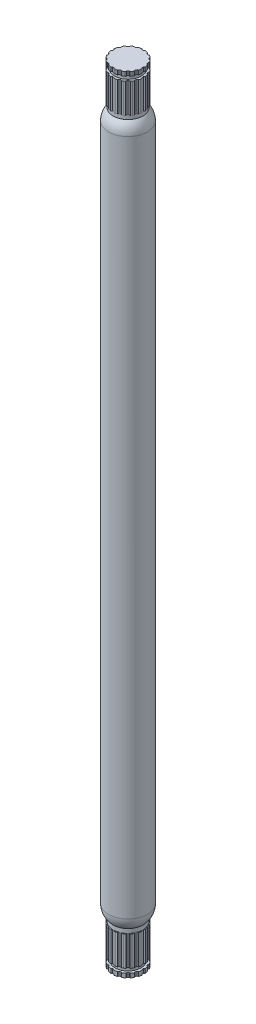
from build123d import *

# Parameters (mm, degrees)
SKETCH1_R            = 11.65
BOSS_EXTRUDE1_DEPTH  = 420
SKETCH3_R            = 8.9
BOSS_EXTRUDE2_DEPTH  = 2.5
BOSS_EXTRUDE6_DEPTH  = 17.8
SKETCH8_R            = 8.016748148
BOSS_EXTRUDE7_DEPTH  = 2.5
SKETCH9_R            = 8.016748148
BOSS_EXTRUDE9_DEPTH  = 2.5
FILLET1_R            = 10
SKETCH13_R           = 8.897382702
BOSS_EXTRUDE10_DEPTH = 2.5
BOSS_EXTRUDE11_DEPTH = 17.8
SKETCH15_R           = 7.804863568
BOSS_EXTRUDE12_DEPTH = 2.5
BOSS_EXTRUDE15_DEPTH = 2.5
FILLET2_R            = 10


with BuildPart() as part:
    # Sketch1 → Boss-Extrude1 (new body)
    with BuildSketch(Plane(origin=(0, 0, 0), x_dir=(1, 0, 0), z_dir=(0, 1, 0))):
        with Locations(Location((0, 0, 0), (0, 0, 90))):
            Circle(SKETCH1_R)
    extrude(amount=BOSS_EXTRUDE1_DEPTH)

    # Sketch3 → Boss-Extrude2 (add)
    with BuildSketch(Plane(origin=(0, 420, 0), x_dir=(1, 0, 0), z_dir=(0, 1, 0))):
        with Locations(Location((0, 0, 0), (0, 0, 270))):
            Circle(SKETCH3_R)
    extrude(amount=BOSS_EXTRUDE2_DEPTH)

    # Sketch4 → Boss-Extrude6 (add)
    with BuildSketch(Plane(origin=(0, 422.5, 0), x_dir=(1, 0, 0), z_dir=(0, 1, 0))):
        with BuildLine():
            Line((0.45, 8.888616315), (-0.45, 8.888616315))
            ThreePointArc((-0.45, 8.888616315), (-1.736303866, 8.728988996), (-2.985780411, 8.384218231))
            Line((-2.985780411, 8.384218231), (-3.81727199, 8.039803141))
            ThreePointArc((-3.81727199, 8.039803141), (-4.944575074, 7.400079549), (-5.96700282, 6.603398923))
            Line((-5.96700282, 6.603398923), (-6.603398923, 5.96700282))
            ThreePointArc((-6.603398923, 5.96700282), (-7.400079549, 4.944575074), (-8.039803141, 3.81727199))
            Line((-8.039803141, 3.81727199), (-8.384218231, 2.985780411))
            ThreePointArc((-8.384218231, 2.985780411), (-8.728988996, 1.736303866), (-8.888616315, 0.45))
            Line((-8.888616315, 0.45), (-8.888616315, -0.45))
            ThreePointArc((-8.888616315, -0.45), (-8.728988996, -1.736303866), (-8.384218231, -2.985780411))
            Line((-8.384218231, -2.985780411), (-8.039803141, -3.81727199))
            ThreePointArc((-8.039803141, -3.81727199), (-7.400079549, -4.944575074), (-6.603398923, -5.96700282))
            Line((-6.603398923, -5.96700282), (-5.96700282, -6.603398923))
            ThreePointArc((-5.96700282, -6.603398923), (-4.944575074, -7.400079549), (-3.81727199, -8.039803141))
            Line((-3.81727199, -8.039803141), (-2.985780411, -8.384218231))
            ThreePointArc((-2.985780411, -8.384218231), (-1.736303866, -8.728988996), (-0.45, -8.888616315))
            Line((-0.45, -8.888616315), (0.45, -8.888616315))
            ThreePointArc((0.45, -8.888616315), (1.736303866, -8.728988996), (2.985780411, -8.384218231))
            Line((2.985780411, -8.384218231), (3.81727199, -8.039803141))
            ThreePointArc((3.81727199, -8.039803141), (4.944575074, -7.400079549), (5.96700282, -6.603398923))
            Line((5.96700282, -6.603398923), (6.603398923, -5.96700282))
            ThreePointArc((6.603398923, -5.96700282), (7.400079549, -4.944575074), (8.039803141, -3.81727199))
            Line((8.039803141, -3.81727199), (8.384218231, -2.985780411))
            ThreePointArc((8.384218231, -2.985780411), (8.728988996, -1.736303866), (8.888616315, -0.45))
            Line((8.888616315, -0.45), (8.888616315, 0.45))
            ThreePointArc((8.888616315, 0.45), (8.728988996, 1.736303866), (8.384218231, 2.985780411))
            Line((8.384218231, 2.985780411), (8.039803141, 3.81727199))
            ThreePointArc((8.039803141, 3.81727199), (7.400079549, 4.944575074), (6.603398923, 5.96700282))
            Line((6.603398923, 5.96700282), (5.96700282, 6.603398923))
            ThreePointArc((5.96700282, 6.603398923), (4.944575074, 7.400079549), (3.81727199, 8.039803141))
            Line((3.81727199, 8.039803141), (2.985780411, 8.384218231))
            ThreePointArc((2.985780411, 8.384218231), (1.736303866, 8.728988996), (0.45, 8.888616315))
        make_face()
        with BuildLine():
            ThreePointArc((-2.985780411, 8.384218231), (-1.736303866, 8.728988996), (-0.45, 8.888616315))
            Line((-0.45, 8.888616315), (-0.980300964, 9.392563005))
            Line((-0.980300964, 9.392563005), (-1.835174079, 9.226043123))
            Line((-1.835174079, 9.226043123), (-2.688698253, 9.052741656))
            Line((-2.688698253, 9.052741656), (-2.985780411, 8.384218231))
        make_face()
        with BuildLine():
            ThreePointArc((-5.96700282, 6.603398923), (-4.944575074, 7.400079549), (-3.81727199, 8.039803141))
            Line((-3.81727199, 8.039803141), (-4.500058246, 8.30245178))
            Line((-4.500058246, 8.30245178), (-5.22613362, 7.821461692))
            Line((-5.22613362, 7.821461692), (-5.948367534, 7.334722453))
            Line((-5.948367534, 7.334722453), (-5.96700282, 6.603398923))
        make_face()
        with BuildLine():
            ThreePointArc((-8.039803141, 3.81727199), (-7.400079549, 4.944575074), (-6.603398923, 5.96700282))
            Line((-6.603398923, 5.96700282), (-7.334722453, 5.948367534))
            Line((-7.334722453, 5.948367534), (-7.821461692, 5.22613362))
            Line((-7.821461692, 5.22613362), (-8.30245178, 4.500058246))
            Line((-8.30245178, 4.500058246), (-8.039803141, 3.81727199))
        make_face()
        with BuildLine():
            ThreePointArc((-8.888616315, 0.45), (-8.728988996, 1.736303866), (-8.384218231, 2.985780411))
            Line((-8.384218231, 2.985780411), (-9.052741656, 2.688698253))
            Line((-9.052741656, 2.688698253), (-9.226043123, 1.835174079))
            Line((-9.226043123, 1.835174079), (-9.392563005, 0.980300964))
            Line((-9.392563005, 0.980300964), (-8.888616315, 0.45))
        make_face()
        with BuildLine():
            Line((4.500058246, 8.30245178), (3.81727199, 8.039803141))
            ThreePointArc((3.81727199, 8.039803141), (4.944575074, 7.400079549), (5.96700282, 6.603398923))
            Line((5.96700282, 6.603398923), (5.948367534, 7.334722453))
            Line((5.948367534, 7.334722453), (5.22613362, 7.821461692))
            Line((5.22613362, 7.821461692), (4.500058246, 8.30245178))
        make_face()
        with BuildLine():
            Line((0.980300964, 9.392563005), (0.45, 8.888616315))
            ThreePointArc((0.45, 8.888616315), (1.736303866, 8.728988996), (2.985780411, 8.384218231))
            Line((2.985780411, 8.384218231), (2.688698253, 9.052741656))
            Line((2.688698253, 9.052741656), (1.835174079, 9.226043123))
            Line((1.835174079, 9.226043123), (0.980300964, 9.392563005))
        make_face()
        with BuildLine():
            Line((7.334722453, 5.948367534), (6.603398923, 5.96700282))
            ThreePointArc((6.603398923, 5.96700282), (7.400079549, 4.944575074), (8.039803141, 3.81727199))
            Line((8.039803141, 3.81727199), (8.30245178, 4.500058246))
            Line((8.30245178, 4.500058246), (7.821461692, 5.22613362))
            Line((7.821461692, 5.22613362), (7.334722453, 5.948367534))
        make_face()
        with BuildLine():
            Line((9.052741656, 2.688698253), (8.384218231, 2.985780411))
            ThreePointArc((8.384218231, 2.985780411), (8.728988996, 1.736303866), (8.888616315, 0.45))
            Line((8.888616315, 0.45), (9.392563005, 0.980300964))
            Line((9.392563005, 0.980300964), (9.226043123, 1.835174079))
            Line((9.226043123, 1.835174079), (9.052741656, 2.688698253))
        make_face()
        with BuildLine():
            Line((9.392563005, -0.980300964), (8.888616315, -0.45))
            ThreePointArc((8.888616315, -0.45), (8.728988996, -1.736303866), (8.384218231, -2.985780411))
            Line((8.384218231, -2.985780411), (9.052741656, -2.688698253))
            Line((9.052741656, -2.688698253), (9.226043123, -1.835174079))
            Line((9.226043123, -1.835174079), (9.392563005, -0.980300964))
        make_face()
        with BuildLine():
            Line((8.30245178, -4.500058246), (8.039803141, -3.81727199))
            ThreePointArc((8.039803141, -3.81727199), (7.400079549, -4.944575074), (6.603398923, -5.96700282))
            Line((6.603398923, -5.96700282), (7.334722453, -5.948367534))
            Line((7.334722453, -5.948367534), (7.821461692, -5.22613362))
            Line((7.821461692, -5.22613362), (8.30245178, -4.500058246))
        make_face()
        with BuildLine():
            Line((5.948367534, -7.334722453), (5.96700282, -6.603398923))
            ThreePointArc((5.96700282, -6.603398923), (4.944575074, -7.400079549), (3.81727199, -8.039803141))
            Line((3.81727199, -8.039803141), (4.500058246, -8.30245178))
            Line((4.500058246, -8.30245178), (5.22613362, -7.821461692))
            Line((5.22613362, -7.821461692), (5.948367534, -7.334722453))
        make_face()
        with BuildLine():
            Line((2.688698253, -9.052741656), (2.985780411, -8.384218231))
            ThreePointArc((2.985780411, -8.384218231), (1.736303866, -8.728988996), (0.45, -8.888616315))
            Line((0.45, -8.888616315), (0.980300964, -9.392563005))
            Line((0.980300964, -9.392563005), (1.835174079, -9.226043123))
            Line((1.835174079, -9.226043123), (2.688698253, -9.052741656))
        make_face()
        with BuildLine():
            ThreePointArc((-0.45, -8.888616315), (-1.736303866, -8.728988996), (-2.985780411, -8.384218231))
            Line((-2.985780411, -8.384218231), (-2.688698253, -9.052741656))
            Line((-2.688698253, -9.052741656), (-1.835174079, -9.226043123))
            Line((-1.835174079, -9.226043123), (-0.980300964, -9.392563005))
            Line((-0.980300964, -9.392563005), (-0.45, -8.888616315))
        make_face()
        with BuildLine():
            ThreePointArc((-3.81727199, -8.039803141), (-4.944575074, -7.400079549), (-5.96700282, -6.603398923))
            Line((-5.96700282, -6.603398923), (-5.948367534, -7.334722453))
            Line((-5.948367534, -7.334722453), (-5.22613362, -7.821461692))
            Line((-5.22613362, -7.821461692), (-4.500058246, -8.30245178))
            Line((-4.500058246, -8.30245178), (-3.81727199, -8.039803141))
        make_face()
        with BuildLine():
            ThreePointArc((-6.603398923, -5.96700282), (-7.400079549, -4.944575074), (-8.039803141, -3.81727199))
            Line((-8.039803141, -3.81727199), (-8.30245178, -4.500058246))
            Line((-8.30245178, -4.500058246), (-7.821461692, -5.22613362))
            Line((-7.821461692, -5.22613362), (-7.334722453, -5.948367534))
            Line((-7.334722453, -5.948367534), (-6.603398923, -5.96700282))
        make_face()
        with BuildLine():
            ThreePointArc((-8.384218231, -2.985780411), (-8.728988996, -1.736303866), (-8.888616315, -0.45))
            Line((-8.888616315, -0.45), (-9.392563005, -0.980300964))
            Line((-9.392563005, -0.980300964), (-9.226043123, -1.835174079))
            Line((-9.226043123, -1.835174079), (-9.052741656, -2.688698253))
            Line((-9.052741656, -2.688698253), (-8.384218231, -2.985780411))
        make_face()
    extrude(amount=BOSS_EXTRUDE6_DEPTH)

    # Sketch8 → Boss-Extrude7 (add)
    with BuildSketch(Plane(origin=(0, 440.3, 0), x_dir=(1, 0, 0), z_dir=(0, 1, 0))):
        with Locations(Location((0, 0, 0), (0, 0, 270))):
            Circle(SKETCH8_R)
    extrude(amount=BOSS_EXTRUDE7_DEPTH)

    # Sketch9 → Boss-Extrude9 (add)
    # profile 1 of 17: a face of its own
    with BuildSketch(Plane(origin=(0, 442.8, 0), x_dir=(1, 0, 0), z_dir=(0, 1, 0))):
        with BuildLine():
            Line((0.45, 8.888616315), (-0.45, 8.888616315))
            ThreePointArc((-0.45, 8.888616315), (-1.736303866, 8.728988996), (-2.985780411, 8.384218231))
            Line((-2.985780411, 8.384218231), (-3.81727199, 8.039803141))
            Line((-3.81727199, 8.039803141), (-4.454837176, 8.285056509))
            ThreePointArc((-4.454837176, 8.285056509), (-4.736292844, 8.127439062), (-5.012178687, 7.960263841))
            Line((-5.012178687, 7.960263841), (-5.436247093, 7.676910392))
            ThreePointArc((-5.436247093, 7.676910392), (-5.696273799, 7.486000296), (-5.949601753, 7.28628675))
            Line((-5.949601753, 7.28628675), (-5.96700282, 6.603398923))
            Line((-5.96700282, 6.603398923), (-6.603398923, 5.96700282))
            ThreePointArc((-6.603398923, 5.96700282), (-7.400079549, 4.944575074), (-8.039803141, 3.81727199))
            Line((-8.039803141, 3.81727199), (-8.384218231, 2.985780411))
            ThreePointArc((-8.384218231, 2.985780411), (-8.728988996, 1.736303866), (-8.888616315, 0.45))
            Line((-8.888616315, 0.45), (-8.888616315, -0.45))
            ThreePointArc((-8.888616315, -0.45), (-8.728988996, -1.736303866), (-8.384218231, -2.985780411))
            Line((-8.384218231, -2.985780411), (-8.039803141, -3.81727199))
            ThreePointArc((-8.039803141, -3.81727199), (-7.400079549, -4.944575074), (-6.603398923, -5.96700282))
            Line((-6.603398923, -5.96700282), (-5.96700282, -6.603398923))
            ThreePointArc((-5.96700282, -6.603398923), (-4.944575074, -7.400079549), (-3.81727199, -8.039803141))
            Line((-3.81727199, -8.039803141), (-2.985780411, -8.384218231))
            ThreePointArc((-2.985780411, -8.384218231), (-1.736303866, -8.728988996), (-0.45, -8.888616315))
            Line((-0.45, -8.888616315), (0.45, -8.888616315))
            ThreePointArc((0.45, -8.888616315), (1.736303866, -8.728988996), (2.985780411, -8.384218231))
            Line((2.985780411, -8.384218231), (3.81727199, -8.039803141))
            ThreePointArc((3.81727199, -8.039803141), (4.944575074, -7.400079549), (5.96700282, -6.603398923))
            Line((5.96700282, -6.603398923), (6.603398923, -5.96700282))
            ThreePointArc((6.603398923, -5.96700282), (7.400079549, -4.944575074), (8.039803141, -3.81727199))
            Line((8.039803141, -3.81727199), (8.384218231, -2.985780411))
            ThreePointArc((8.384218231, -2.985780411), (8.728988996, -1.736303866), (8.888616315, -0.45))
            Line((8.888616315, -0.45), (8.888616315, 0.45))
            ThreePointArc((8.888616315, 0.45), (8.728988996, 1.736303866), (8.384218231, 2.985780411))
            Line((8.384218231, 2.985780411), (8.039803141, 3.81727199))
            ThreePointArc((8.039803141, 3.81727199), (7.400079549, 4.944575074), (6.603398923, 5.96700282))
            Line((6.603398923, 5.96700282), (5.96700282, 6.603398923))
            ThreePointArc((5.96700282, 6.603398923), (4.944575074, 7.400079549), (3.81727199, 8.039803141))
            Line((3.81727199, 8.039803141), (2.985780411, 8.384218231))
            ThreePointArc((2.985780411, 8.384218231), (1.736303866, 8.728988996), (0.45, 8.888616315))
        make_face()
        with Locations(Location((0, 0, 0), (0, 0, 270))):
            Circle(SKETCH9_R, mode=Mode.SUBTRACT)
    # profile 2 of 17: a face of its own
    with BuildSketch(Plane(origin=(0, 442.8, 0), x_dir=(1, 0, 0), z_dir=(0, 1, 0))):
        with Locations(Location((0, 0, 0), (0, 0, 270))):
            Circle(SKETCH9_R)
    # profile 3 of 17: a face of its own
    with BuildSketch(Plane(origin=(0, 442.8, 0), x_dir=(1, 0, 0), z_dir=(0, 1, 0))):
        with BuildLine():
            ThreePointArc((-8.039803141, 3.81727199), (-7.400079549, 4.944575074), (-6.603398923, 5.96700282))
            Line((-6.603398923, 5.96700282), (-7.28628675, 5.949601753))
            ThreePointArc((-7.28628675, 5.949601753), (-7.486000296, 5.696273799), (-7.676910392, 5.436247093))
            Line((-7.676910392, 5.436247093), (-7.960263841, 5.012178687))
            ThreePointArc((-7.960263841, 5.012178687), (-8.127439062, 4.736292844), (-8.285056509, 4.454837176))
            Line((-8.285056509, 4.454837176), (-8.039803141, 3.81727199))
        make_face()
    # profile 4 of 17: a face of its own
    with BuildSketch(Plane(origin=(0, 442.8, 0), x_dir=(1, 0, 0), z_dir=(0, 1, 0))):
        with BuildLine():
            ThreePointArc((-8.888616315, 0.45), (-8.728988996, 1.736303866), (-8.384218231, 2.985780411))
            Line((-8.384218231, 2.985780411), (-9.008465216, 2.708374064))
            ThreePointArc((-9.008465216, 2.708374064), (-9.096032062, 2.397902487), (-9.17290208, 2.084611004))
            Line((-9.17290208, 2.084611004), (-9.27240258, 1.584388213))
            ThreePointArc((-9.27240258, 1.584388213), (-9.321275404, 1.265527742), (-9.359186515, 0.945179026))
            Line((-9.359186515, 0.945179026), (-8.888616315, 0.45))
        make_face()
    # profile 5 of 17: a face of its own
    with BuildSketch(Plane(origin=(0, 442.8, 0), x_dir=(1, 0, 0), z_dir=(0, 1, 0))):
        with BuildLine():
            ThreePointArc((-8.384218231, -2.985780411), (-8.728988996, -1.736303866), (-8.888616315, -0.45))
            Line((-8.888616315, -0.45), (-9.359186515, -0.945179026))
            ThreePointArc((-9.359186515, -0.945179026), (-9.321275404, -1.265527742), (-9.27240258, -1.584388213))
            Line((-9.27240258, -1.584388213), (-9.17290208, -2.084611004))
            ThreePointArc((-9.17290208, -2.084611004), (-9.096032062, -2.397902487), (-9.008465216, -2.708374064))
            Line((-9.008465216, -2.708374064), (-8.384218231, -2.985780411))
        make_face()
    # profile 6 of 17: a face of its own
    with BuildSketch(Plane(origin=(0, 442.8, 0), x_dir=(1, 0, 0), z_dir=(0, 1, 0))):
        with BuildLine():
            ThreePointArc((-6.603398923, -5.96700282), (-7.400079549, -4.944575074), (-8.039803141, -3.81727199))
            Line((-8.039803141, -3.81727199), (-8.285056509, -4.454837176))
            ThreePointArc((-8.285056509, -4.454837176), (-8.127439062, -4.736292844), (-7.960263841, -5.012178687))
            Line((-7.960263841, -5.012178687), (-7.676910392, -5.436247093))
            ThreePointArc((-7.676910392, -5.436247093), (-7.486000296, -5.696273799), (-7.28628675, -5.949601753))
            Line((-7.28628675, -5.949601753), (-6.603398923, -5.96700282))
        make_face()
    # profile 7 of 17: a face of its own
    with BuildSketch(Plane(origin=(0, 442.8, 0), x_dir=(1, 0, 0), z_dir=(0, 1, 0))):
        with BuildLine():
            ThreePointArc((-3.81727199, -8.039803141), (-4.944575074, -7.400079549), (-5.96700282, -6.603398923))
            Line((-5.96700282, -6.603398923), (-5.949601753, -7.28628675))
            ThreePointArc((-5.949601753, -7.28628675), (-5.696273799, -7.486000296), (-5.436247093, -7.676910392))
            Line((-5.436247093, -7.676910392), (-5.012178687, -7.960263841))
            ThreePointArc((-5.012178687, -7.960263841), (-4.736292844, -8.127439062), (-4.454837176, -8.285056509))
            Line((-4.454837176, -8.285056509), (-3.81727199, -8.039803141))
        make_face()
    # profile 8 of 17: a face of its own
    with BuildSketch(Plane(origin=(0, 442.8, 0), x_dir=(1, 0, 0), z_dir=(0, 1, 0))):
        with BuildLine():
            Line((-0.945179026, -9.359186515), (-0.45, -8.888616315))
            ThreePointArc((-0.45, -8.888616315), (-1.736303866, -8.728988996), (-2.985780411, -8.384218231))
            Line((-2.985780411, -8.384218231), (-2.708374064, -9.008465216))
            ThreePointArc((-2.708374064, -9.008465216), (-2.397902487, -9.096032062), (-2.084611004, -9.17290208))
            Line((-2.084611004, -9.17290208), (-1.584388213, -9.27240258))
            ThreePointArc((-1.584388213, -9.27240258), (-1.265527742, -9.321275404), (-0.945179026, -9.359186515))
        make_face()
    # profile 9 of 17: a face of its own
    with BuildSketch(Plane(origin=(0, 442.8, 0), x_dir=(1, 0, 0), z_dir=(0, 1, 0))):
        with BuildLine():
            Line((2.708374064, -9.008465216), (2.985780411, -8.384218231))
            ThreePointArc((2.985780411, -8.384218231), (1.736303866, -8.728988996), (0.45, -8.888616315))
            Line((0.45, -8.888616315), (0.945179026, -9.359186515))
            ThreePointArc((0.945179026, -9.359186515), (1.265527742, -9.321275404), (1.584388213, -9.27240258))
            Line((1.584388213, -9.27240258), (2.084611004, -9.17290208))
            ThreePointArc((2.084611004, -9.17290208), (2.397902487, -9.096032062), (2.708374064, -9.008465216))
        make_face()
    # profile 10 of 17: a face of its own
    with BuildSketch(Plane(origin=(0, 442.8, 0), x_dir=(1, 0, 0), z_dir=(0, 1, 0))):
        with BuildLine():
            Line((5.949601753, -7.28628675), (5.96700282, -6.603398923))
            ThreePointArc((5.96700282, -6.603398923), (4.944575074, -7.400079549), (3.81727199, -8.039803141))
            Line((3.81727199, -8.039803141), (4.454837176, -8.285056509))
            ThreePointArc((4.454837176, -8.285056509), (4.736292844, -8.127439062), (5.012178687, -7.960263841))
            Line((5.012178687, -7.960263841), (5.436247093, -7.676910392))
            ThreePointArc((5.436247093, -7.676910392), (5.696273799, -7.486000296), (5.949601753, -7.28628675))
        make_face()
    # profile 11 of 17: a face of its own
    with BuildSketch(Plane(origin=(0, 442.8, 0), x_dir=(1, 0, 0), z_dir=(0, 1, 0))):
        with BuildLine():
            Line((8.285056509, -4.454837176), (8.039803141, -3.81727199))
            ThreePointArc((8.039803141, -3.81727199), (7.400079549, -4.944575074), (6.603398923, -5.96700282))
            Line((6.603398923, -5.96700282), (7.28628675, -5.949601753))
            ThreePointArc((7.28628675, -5.949601753), (7.486000296, -5.696273799), (7.676910392, -5.436247093))
            Line((7.676910392, -5.436247093), (7.960263841, -5.012178687))
            ThreePointArc((7.960263841, -5.012178687), (8.127439062, -4.736292844), (8.285056509, -4.454837176))
        make_face()
    # profile 12 of 17: a face of its own
    with BuildSketch(Plane(origin=(0, 442.8, 0), x_dir=(1, 0, 0), z_dir=(0, 1, 0))):
        with BuildLine():
            Line((9.359186515, -0.945179026), (8.888616315, -0.45))
            ThreePointArc((8.888616315, -0.45), (8.728988996, -1.736303866), (8.384218231, -2.985780411))
            Line((8.384218231, -2.985780411), (9.008465216, -2.708374064))
            ThreePointArc((9.008465216, -2.708374064), (9.096032062, -2.397902487), (9.17290208, -2.084611004))
            Line((9.17290208, -2.084611004), (9.27240258, -1.584388213))
            ThreePointArc((9.27240258, -1.584388213), (9.321275404, -1.265527742), (9.359186515, -0.945179026))
        make_face()
    # profile 13 of 17: a face of its own
    with BuildSketch(Plane(origin=(0, 442.8, 0), x_dir=(1, 0, 0), z_dir=(0, 1, 0))):
        with BuildLine():
            Line((9.008465216, 2.708374064), (8.384218231, 2.985780411))
            ThreePointArc((8.384218231, 2.985780411), (8.728988996, 1.736303866), (8.888616315, 0.45))
            Line((8.888616315, 0.45), (9.359186515, 0.945179026))
            ThreePointArc((9.359186515, 0.945179026), (9.321275404, 1.265527742), (9.27240258, 1.584388213))
            Line((9.27240258, 1.584388213), (9.17290208, 2.084611004))
            ThreePointArc((9.17290208, 2.084611004), (9.096032062, 2.397902487), (9.008465216, 2.708374064))
        make_face()
    # profile 14 of 17: a face of its own
    with BuildSketch(Plane(origin=(0, 442.8, 0), x_dir=(1, 0, 0), z_dir=(0, 1, 0))):
        with BuildLine():
            Line((7.28628675, 5.949601753), (6.603398923, 5.96700282))
            ThreePointArc((6.603398923, 5.96700282), (7.400079549, 4.944575074), (8.039803141, 3.81727199))
            Line((8.039803141, 3.81727199), (8.285056509, 4.454837176))
            ThreePointArc((8.285056509, 4.454837176), (8.127439062, 4.736292844), (7.960263841, 5.012178687))
            Line((7.960263841, 5.012178687), (7.676910392, 5.436247093))
            ThreePointArc((7.676910392, 5.436247093), (7.486000296, 5.696273799), (7.28628675, 5.949601753))
        make_face()
    # profile 15 of 17: a face of its own
    with BuildSketch(Plane(origin=(0, 442.8, 0), x_dir=(1, 0, 0), z_dir=(0, 1, 0))):
        with BuildLine():
            Line((4.454837176, 8.285056509), (3.81727199, 8.039803141))
            ThreePointArc((3.81727199, 8.039803141), (4.944575074, 7.400079549), (5.96700282, 6.603398923))
            Line((5.96700282, 6.603398923), (5.949601753, 7.28628675))
            ThreePointArc((5.949601753, 7.28628675), (5.696273799, 7.486000296), (5.436247093, 7.676910392))
            Line((5.436247093, 7.676910392), (5.012178687, 7.960263841))
            ThreePointArc((5.012178687, 7.960263841), (4.736292844, 8.127439062), (4.454837176, 8.285056509))
        make_face()
    # profile 16 of 17: a face of its own
    with BuildSketch(Plane(origin=(0, 442.8, 0), x_dir=(1, 0, 0), z_dir=(0, 1, 0))):
        with BuildLine():
            ThreePointArc((-2.985780411, 8.384218231), (-1.736303866, 8.728988996), (-0.45, 8.888616315))
            Line((-0.45, 8.888616315), (-0.945179026, 9.359186515))
            ThreePointArc((-0.945179026, 9.359186515), (-1.265527742, 9.321275404), (-1.584388213, 9.27240258))
            Line((-1.584388213, 9.27240258), (-2.084611004, 9.17290208))
            ThreePointArc((-2.084611004, 9.17290208), (-2.397902487, 9.096032062), (-2.708374064, 9.008465216))
            Line((-2.708374064, 9.008465216), (-2.985780411, 8.384218231))
        make_face()
    # profile 17 of 17: a face of its own
    with BuildSketch(Plane(origin=(0, 442.8, 0), x_dir=(1, 0, 0), z_dir=(0, 1, 0))):
        with BuildLine():
            Line((0.945179026, 9.359186515), (0.45, 8.888616315))
            ThreePointArc((0.45, 8.888616315), (1.736303866, 8.728988996), (2.985780411, 8.384218231))
            Line((2.985780411, 8.384218231), (2.708374064, 9.008465216))
            ThreePointArc((2.708374064, 9.008465216), (2.397902487, 9.096032062), (2.084611004, 9.17290208))
            Line((2.084611004, 9.17290208), (1.584388213, 9.27240258))
            ThreePointArc((1.584388213, 9.27240258), (1.265527742, 9.321275404), (0.945179026, 9.359186515))
        make_face()
    extrude(amount=BOSS_EXTRUDE9_DEPTH)

    # Fillet1
    # the kernel refuses this fillet: 10 mm, written as the material it takes off along each edge
    with BuildSketch(Plane(origin=(0, 420, 0), x_dir=(0, 0, -1), z_dir=(1, 0, 0))) as fillet1_piece_1_section:
        with BuildLine():
            CenterArc((1.65, -6.887488657), FILLET1_R, 0, 43.531152167)
            Line((11.65, -6.887488657), (11.85, -6.887488657))
            Line((11.85, -6.887488657), (11.85, 0))
            Line((11.85, 0), (11.65, 0.2))
            ThreePointArc((11.65, 0.2), (10.275, 0.2), (9.045, 0.137749773))
            Line((9.045, 0.137749773), (8.9, 0))
        make_face()
    fillet1_piece_1 = revolve(axis=Axis((0, 420, 0), (0, 1, 0)), mode=Mode.PRIVATE)
    fillet1_piece_1 = fillet1_piece_1 - Plane(origin=(0, 416.850802747, 0), x_dir=(0, 0, 1), z_dir=(0, -1, 0)) * Cylinder(8.9, 48, mode=Mode.PRIVATE)
    add(fillet1_piece_1, mode=Mode.SUBTRACT)

    # Sketch13 → Boss-Extrude10 (add)
    with BuildSketch(Plane.XZ):
        with Locations(Location((0, 0, 0), (0, 0, 270))):
            Circle(SKETCH13_R)
    extrude(amount=BOSS_EXTRUDE10_DEPTH)

    # Sketch14 → Boss-Extrude11 (add)
    with BuildSketch(Plane.XZ.offset(2.5)):
        Polygon((0.408427035, 8.885811164), (-0.408427035, 8.885811164), (-0.455707732, 8.885811164), (-0.956971521, 9.387074953), (-1.95884562, 9.202875892), (-2.721117428, 9.039705889), (-2.995565895, 8.377128676), (-3.023115337, 8.365717324), (-3.777790094, 8.053120804), (-3.821471762, 8.035027265), (-4.476404464, 8.306309273), (-5.33152551, 7.752730912), (-5.973330374, 7.310272693), (-5.973330374, 6.593104286), (-5.994415804, 6.572018857), (-6.572018857, 5.994415804), (-6.605451358, 5.960983303), (-7.314345407, 5.960983303), (-7.892528971, 5.122302928), (-8.316157919, 4.467916748), (-8.041709452, 3.805339536), (-8.053120804, 3.777790094), (-8.365717324, 3.023115337), (-8.383810863, 2.979433669), (-9.038743566, 2.708151661), (-9.251966443, 1.712050758), (-9.392925808, 0.94536098), (-8.885811164, 0.438246336), (-8.885811164, 0.408427035), (-8.885811164, -0.408427035), (-8.885811164, -0.455707732), (-9.387074953, -0.956971521), (-9.202875892, -1.95884562), (-9.039705889, -2.721117428), (-8.377128676, -2.995565895), (-8.365717324, -3.023115337), (-8.053120804, -3.777790094), (-8.035027265, -3.821471762), (-8.306309273, -4.476404464), (-7.752730912, -5.33152551), (-7.310272693, -5.973330374), (-6.593104286, -5.973330374), (-6.572018857, -5.994415804), (-5.994415804, -6.572018857), (-5.960983303, -6.605451358), (-5.960983303, -7.314345407), (-5.122302928, -7.892528971), (-4.467916748, -8.316157919), (-3.805339536, -8.041709452), (-3.777790094, -8.053120804), (-3.023115337, -8.365717324), (-2.979433669, -8.383810863), (-2.708151661, -9.038743566), (-1.712050758, -9.251966443), (-0.94536098, -9.392925808), (-0.438246336, -8.885811164), (-0.408427035, -8.885811164), (0.408427035, -8.885811164), (0.455707732, -8.885811164), (0.956971521, -9.387074953), (1.95884562, -9.202875892), (2.721117428, -9.039705889), (2.995565895, -8.377128676), (3.023115337, -8.365717324), (3.777790094, -8.053120804), (3.821471762, -8.035027265), (4.476404464, -8.306309273), (5.33152551, -7.752730912), (5.973330374, -7.310272693), (5.973330374, -6.593104286), (5.994415804, -6.572018857), (6.572018857, -5.994415804), (6.605451358, -5.960983303), (7.314345407, -5.960983303), (7.892528971, -5.122302928), (8.316157919, -4.467916748), (8.041709452, -3.805339536), (8.053120804, -3.777790094), (8.365717324, -3.023115337), (8.383810863, -2.979433669), (9.038743566, -2.708151661), (9.251966443, -1.712050758), (9.392925808, -0.94536098), (8.885811164, -0.438246336), (8.885811164, -0.408427035), (8.885811164, 0.408427035), (8.885811164, 0.455707732), (9.387074953, 0.956971521), (9.202875892, 1.95884562), (9.039705889, 2.721117428), (8.377128676, 2.995565895), (8.365717324, 3.023115337), (8.053120804, 3.777790094), (8.035027265, 3.821471762), (8.306309273, 4.476404464), (7.752730912, 5.33152551), (7.310272693, 5.973330374), (6.593104286, 5.973330374), (6.572018857, 5.994415804), (5.994415804, 6.572018857), (5.960983303, 6.605451358), (5.960983303, 7.314345407), (5.122302928, 7.892528971), (4.467916748, 8.316157919), (3.805339536, 8.041709452), (3.777790094, 8.053120804), (3.023115337, 8.365717324), (2.979433669, 8.383810863), (2.708151661, 9.038743566), (1.712050758, 9.251966443), (0.94536098, 9.392925808), (0.438246336, 8.885811164), align=None)
    extrude(amount=BOSS_EXTRUDE11_DEPTH)

    # Sketch15 → Boss-Extrude12 (add)
    with BuildSketch(Plane.XZ.offset(20.3)):
        with Locations(Location((0, 0, 0), (0, 0, 270))):
            Circle(SKETCH15_R)
    extrude(amount=BOSS_EXTRUDE12_DEPTH)

    # Sketch24 → Boss-Extrude15 (add)
    with BuildSketch(Plane.XZ.offset(22.8)):
        with BuildLine():
            Line((-0.455707732, 8.885811164), (-0.956971521, 9.387074953))
            Line((-0.956971521, 9.387074953), (-2.673210301, 9.049139039))
            ThreePointArc((-2.673210301, 9.049139039), (-2.698323685, 9.041682363), (-2.72341627, 9.034155992))
            Line((-2.72341627, 9.034155992), (-2.995565895, 8.377128676))
            Line((-2.995565895, 8.377128676), (-3.821471762, 8.035027265))
            Line((-3.821471762, 8.035027265), (-4.476404464, 8.306309273))
            Line((-4.476404464, 8.306309273), (-5.93267987, 7.337321052))
            ThreePointArc((-5.93267987, 7.337321052), (-5.953028066, 7.320821505), (-5.973330374, 7.304265528))
            Line((-5.973330374, 7.304265528), (-5.973330374, 6.593104286))
            Line((-5.973330374, 6.593104286), (-6.605451358, 5.960983303))
            Line((-6.605451358, 5.960983303), (-7.314345407, 5.960983303))
            Line((-7.314345407, 5.960983303), (-8.28895271, 4.508462448))
            ThreePointArc((-8.28895271, 4.508462448), (-8.301437888, 4.485431937), (-8.313859077, 4.462366851))
            Line((-8.313859077, 4.462366851), (-8.041709452, 3.805339536))
            Line((-8.041709452, 3.805339536), (-8.383810863, 2.979433669))
            Line((-8.383810863, 2.979433669), (-9.038743566, 2.708151661))
            Line((-9.038743566, 2.708151661), (-9.383307639, 0.993231305))
            ThreePointArc((-9.383307639, 0.993231305), (-9.386029044, 0.967176016), (-9.3886781, 0.941113273))
            Line((-9.3886781, 0.941113273), (-8.885811164, 0.438246336))
            Line((-8.885811164, 0.438246336), (-8.885811164, -0.455707732))
            Line((-8.885811164, -0.455707732), (-9.387074953, -0.956971521))
            Line((-9.387074953, -0.956971521), (-9.049139039, -2.673210301))
            ThreePointArc((-9.049139039, -2.673210301), (-9.041682363, -2.698323685), (-9.034155992, -2.72341627))
            Line((-9.034155992, -2.72341627), (-8.377128676, -2.995565895))
            Line((-8.377128676, -2.995565895), (-8.035027265, -3.821471762))
            Line((-8.035027265, -3.821471762), (-8.306309273, -4.476404464))
            Line((-8.306309273, -4.476404464), (-7.337321052, -5.93267987))
            ThreePointArc((-7.337321052, -5.93267987), (-7.320821505, -5.953028066), (-7.304265528, -5.973330374))
            Line((-7.304265528, -5.973330374), (-6.593104286, -5.973330374))
            Line((-6.593104286, -5.973330374), (-5.960983303, -6.605451358))
            Line((-5.960983303, -6.605451358), (-5.960983303, -7.314345407))
            Line((-5.960983303, -7.314345407), (-4.508462448, -8.28895271))
            ThreePointArc((-4.508462448, -8.28895271), (-4.485431937, -8.301437888), (-4.462366851, -8.313859077))
            Line((-4.462366851, -8.313859077), (-3.805339536, -8.041709452))
            Line((-3.805339536, -8.041709452), (-2.979433669, -8.383810863))
            Line((-2.979433669, -8.383810863), (-2.708151661, -9.038743566))
            Line((-2.708151661, -9.038743566), (-0.993231305, -9.383307639))
            ThreePointArc((-0.993231305, -9.383307639), (-0.967176016, -9.386029044), (-0.941113273, -9.3886781))
            Line((-0.941113273, -9.3886781), (-0.438246336, -8.885811164))
            Line((-0.438246336, -8.885811164), (0.455707732, -8.885811164))
            Line((0.455707732, -8.885811164), (0.956971521, -9.387074953))
            Line((0.956971521, -9.387074953), (2.673210301, -9.049139039))
            ThreePointArc((2.673210301, -9.049139039), (2.698323685, -9.041682363), (2.72341627, -9.034155992))
            Line((2.72341627, -9.034155992), (2.995565895, -8.377128676))
            Line((2.995565895, -8.377128676), (3.821471762, -8.035027265))
            Line((3.821471762, -8.035027265), (4.476404464, -8.306309273))
            Line((4.476404464, -8.306309273), (5.93267987, -7.337321052))
            ThreePointArc((5.93267987, -7.337321052), (5.953028066, -7.320821505), (5.973330374, -7.304265528))
            Line((5.973330374, -7.304265528), (5.973330374, -6.593104286))
            Line((5.973330374, -6.593104286), (6.605451358, -5.960983303))
            Line((6.605451358, -5.960983303), (7.314345407, -5.960983303))
            Line((7.314345407, -5.960983303), (8.28895271, -4.508462448))
            ThreePointArc((8.28895271, -4.508462448), (8.301437888, -4.485431937), (8.313859077, -4.462366851))
            Line((8.313859077, -4.462366851), (8.041709452, -3.805339536))
            Line((8.041709452, -3.805339536), (8.383810863, -2.979433669))
            Line((8.383810863, -2.979433669), (9.038743566, -2.708151661))
            Line((9.038743566, -2.708151661), (9.383307639, -0.993231305))
            ThreePointArc((9.383307639, -0.993231305), (9.386029044, -0.967176016), (9.3886781, -0.941113273))
            Line((9.3886781, -0.941113273), (8.885811164, -0.438246336))
            Line((8.885811164, -0.438246336), (8.885811164, 0.455707732))
            Line((8.885811164, 0.455707732), (9.387074953, 0.956971521))
            Line((9.387074953, 0.956971521), (9.049139039, 2.673210301))
            ThreePointArc((9.049139039, 2.673210301), (9.041682363, 2.698323685), (9.034155992, 2.72341627))
            Line((9.034155992, 2.72341627), (8.377128676, 2.995565895))
            Line((8.377128676, 2.995565895), (8.035027265, 3.821471762))
            Line((8.035027265, 3.821471762), (8.306309273, 4.476404464))
            Line((8.306309273, 4.476404464), (7.337321052, 5.93267987))
            ThreePointArc((7.337321052, 5.93267987), (7.320821505, 5.953028066), (7.304265528, 5.973330374))
            Line((7.304265528, 5.973330374), (6.593104286, 5.973330374))
            Line((6.593104286, 5.973330374), (5.960983303, 6.605451358))
            Line((5.960983303, 6.605451358), (5.960983303, 7.314345407))
            Line((5.960983303, 7.314345407), (4.508462448, 8.28895271))
            ThreePointArc((4.508462448, 8.28895271), (4.485431937, 8.301437888), (4.462366851, 8.313859077))
            Line((4.462366851, 8.313859077), (3.805339536, 8.041709452))
            Line((3.805339536, 8.041709452), (2.979433669, 8.383810863))
            Line((2.979433669, 8.383810863), (2.708151661, 9.038743566))
            Line((2.708151661, 9.038743566), (0.993231305, 9.383307639))
            ThreePointArc((0.993231305, 9.383307639), (0.967176016, 9.386029044), (0.941113273, 9.3886781))
            Line((0.941113273, 9.3886781), (0.438246336, 8.885811164))
            Line((0.438246336, 8.885811164), (-0.455707732, 8.885811164))
        make_face()
    extrude(amount=BOSS_EXTRUDE15_DEPTH)

    # Fillet2
    # the kernel refuses this fillet: 10 mm, written as the material it takes off along each edge
    with BuildSketch(Plane(origin=(0, 0, 0), x_dir=(0, 0, -1), z_dir=(1, 0, 0))) as fillet2_piece_1:
        with BuildLine():
            CenterArc((1.65, 6.890242664), FILLET2_R, 316.447079353, 43.552920647)
            Line((11.65, 6.890242664), (11.85, 6.890242664))
            Line((11.85, 6.890242664), (11.85, 0))
            Line((11.85, 0), (11.65, -0.2))
            ThreePointArc((11.65, -0.2), (10.273691351, -0.2), (9.042330356, -0.137804853))
            Line((9.042330356, -0.137804853), (8.897382702, 0))
        make_face()
    revolve(axis=Axis((0, 0, 0), (0, 1, 0)), mode=Mode.SUBTRACT)


solid = part.part
